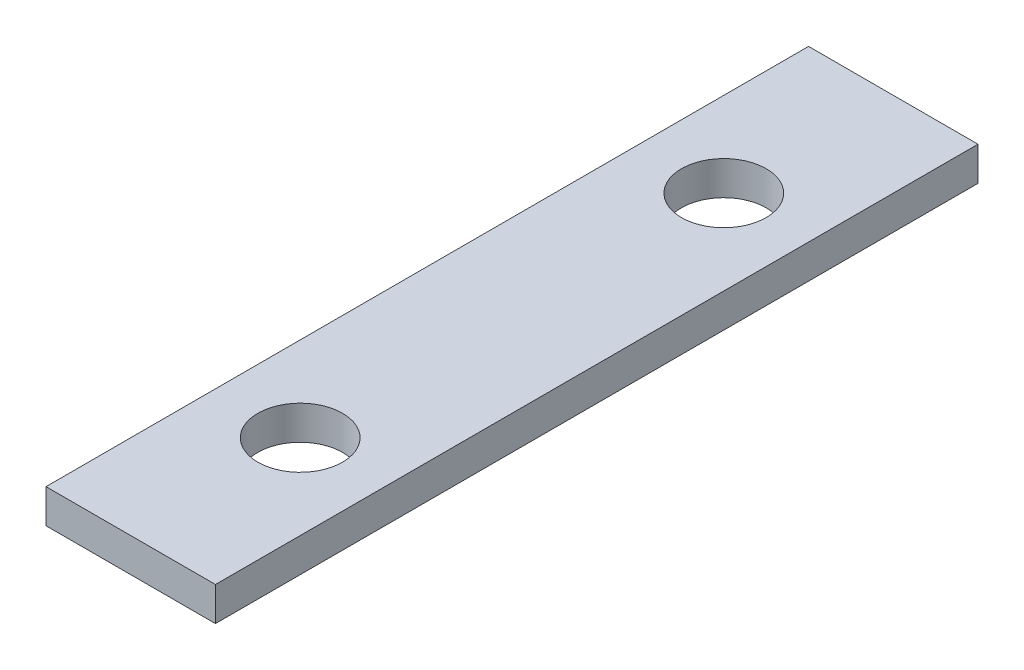
from build123d import *

# Parameters (mm, degrees)
SKETCH_1_W      = 20
SKETCH_1_H      = 90
SKETCH_1_R      = 5
EXTRUDE_1_DEPTH = 4


with BuildPart() as part:
    # Эскиз1 → Бобышка-Вытянуть1 (new body)
    with BuildSketch(Plane(origin=(0, 0, 0), x_dir=(1, 0, 0), z_dir=(0, 1, 0))):
        with Locations((10, 45)):
            Rectangle(SKETCH_1_W, SKETCH_1_H)
        with Locations((10, 20)):
            Circle(SKETCH_1_R, mode=Mode.SUBTRACT)
        with Locations((10, 70)):
            Circle(SKETCH_1_R, mode=Mode.SUBTRACT)
    extrude(amount=EXTRUDE_1_DEPTH)


solid = part.part
